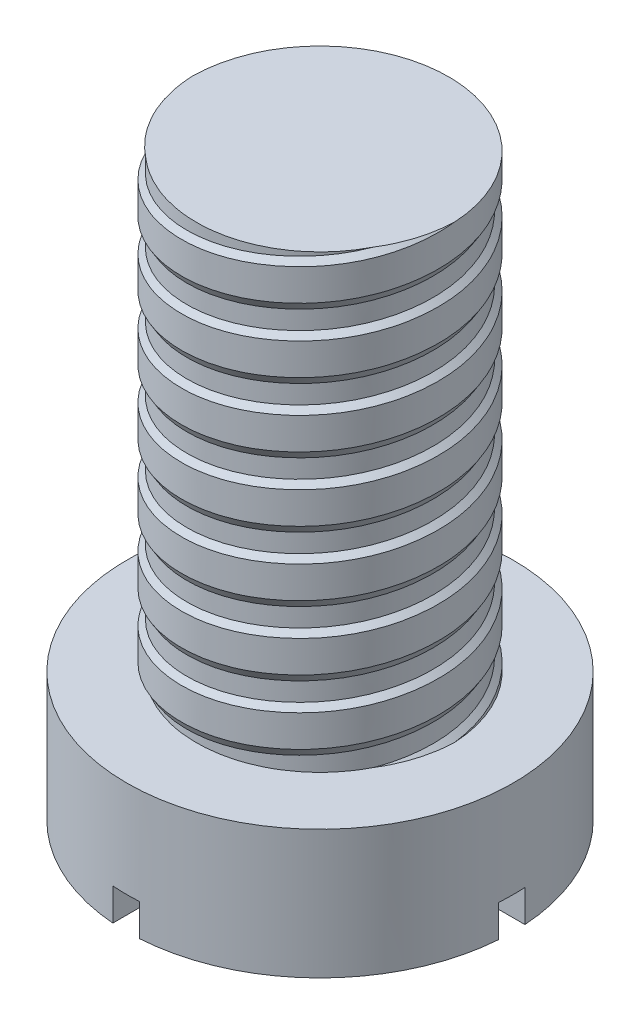
from build123d import *

# Parameters (mm, degrees)
SKETCH1_R           = 3
BOSS_EXTRUDE1_DEPTH = 2
SKETCH2_R           = 2
BOSS_EXTRUDE2_DEPTH = 7
CUT_SWEEP1_PITCH    = 1
CUT_SWEEP1_TO       = 8
SKETCH5_W           = 0.418370382
SKETCH5_H           = 0.410002974
CUT_EXTRUDE1_DEPTH  = 0.5


with BuildPart() as part:
    # Sketch1 → Boss-Extrude1 (new body)
    with BuildSketch(Plane(origin=(0, 0, 0), x_dir=(1, 0, 0), z_dir=(0, 1, 0))):
        with Locations(Location((0, 0, 0), (0, 0, 270))):
            Circle(SKETCH1_R)
    extrude(amount=BOSS_EXTRUDE1_DEPTH)

    # Sketch2 → Boss-Extrude2 (add)
    with BuildSketch(Plane(origin=(0, 2, 0), x_dir=(1, 0, 0), z_dir=(0, 1, 0))):
        with Locations(Location((0, 0, 0), (0, 0, 270))):
            Circle(SKETCH2_R)
    extrude(amount=BOSS_EXTRUDE2_DEPTH)

    # Cut-Sweep1: arcs per turn and ends read off the stored shape
    # Cut-Sweep1: the profile of Sketch4 profile screwed along a right-hand helix through 8.5 turns, 8 arcs to a turn; built about Z, then put on its axis
    cut_sweep1_z = Axis((0, 0, 0), (0, 0, 1))
    cut_sweep1_corners = [(2.000281922, 0, -0.00116889), (1.917384358, 0, 0.136008219), (1.917384358, 0, 0.424438129), (2.000281922, 0, 0.507335693)]
    with BuildLine(mode=Mode.PRIVATE) as cut_sweep1_profile:
        Line(cut_sweep1_corners[0], cut_sweep1_corners[1])
        Line(cut_sweep1_corners[1], cut_sweep1_corners[2])
        Line(cut_sweep1_corners[2], cut_sweep1_corners[3])
        Line(cut_sweep1_corners[3], cut_sweep1_corners[0])
    cut_sweep1_cap = Face(cut_sweep1_profile.wire())
    cut_sweep1_turn_angles = [0, 22.5, 45, 67.5, 90, 112.5, 135, 157.5, 180, 202.5, 225, 247.5, 270, 292.5, 315, 337.5, 360]
    cut_sweep1_turn_weights = [1, 0.9238795325112867, 1, 0.9238795325112867, 1, 0.9238795325112867, 1, 0.9238795325112867, 1, 0.9238795325112867, 1, 0.9238795325112867, 1, 0.9238795325112867, 1, 0.9238795325112867, 1]
    cut_sweep1_turn_rails = [Edge.make_bspline([Vector(p[0], p[1], 0).rotate(cut_sweep1_z, cut_sweep1_turn_angles[k]) / cut_sweep1_turn_weights[k] + Vector(0, 0, p[2] + CUT_SWEEP1_PITCH * cut_sweep1_turn_angles[k] / 360) for k in range(17)], [0, 0, 0, 1, 1, 2, 2, 3, 3, 4, 4, 5, 5, 6, 6, 7, 7, 8, 8, 8], 2, cut_sweep1_turn_weights) for p in cut_sweep1_corners]
    cut_sweep1_turn_sides = [Face.make_surface_from_curves(cut_sweep1_turn_rails[p[0]], cut_sweep1_turn_rails[p[1]]) for p in [(0, 1), (1, 2), (2, 3), (3, 0)]]
    cut_sweep1_last_angles = [2880, 2902.5, 2925, 2947.5, 2970, 2992.5, 3015, 3037.5, 3060]
    cut_sweep1_last_weights = [1, 0.9238795325112867, 1, 0.9238795325112867, 1, 0.9238795325112867, 1, 0.9238795325112867, 1]
    cut_sweep1_last_rails = [Edge.make_bspline([Vector(p[0], p[1], 0).rotate(cut_sweep1_z, cut_sweep1_last_angles[k]) / cut_sweep1_last_weights[k] + Vector(0, 0, p[2] + CUT_SWEEP1_PITCH * cut_sweep1_last_angles[k] / 360) for k in range(9)], [0, 0, 0, 1, 1, 2, 2, 3, 3, 4, 4, 4], 2, cut_sweep1_last_weights) for p in cut_sweep1_corners]
    cut_sweep1_last_sides = [Face.make_surface_from_curves(cut_sweep1_last_rails[p[0]], cut_sweep1_last_rails[p[1]]) for p in [(0, 1), (1, 2), (2, 3), (3, 0)]]
    cut_sweep1 = Plane(origin=(0, 10, 0), x_dir=(-1, 0, 0), z_dir=(0, -1, 0)) * split(Solid(Shell([*[p.moved(Location((0, 0, CUT_SWEEP1_PITCH * i))) for i in range(8) for p in cut_sweep1_turn_sides], *cut_sweep1_last_sides, cut_sweep1_cap, cut_sweep1_cap.rotate(cut_sweep1_z, 3060).moved(Location((0, 0, CUT_SWEEP1_PITCH * 3060 / 360)))])), bisect_by=Plane.XY.offset(CUT_SWEEP1_TO), keep=Keep.BOTTOM, mode=Mode.PRIVATE)
    add(cut_sweep1, mode=Mode.SUBTRACT)

    # Sketch5 → Cut-Extrude1 (cut)
    with BuildSketch(Plane.XZ):
        with BuildLine():
            Line((-0.225920006, -0.188266672), (-0.225920006, 0.221736302))
            Line((-0.225920006, 0.221736302), (-2.99179428, 0.221736302))
            ThreePointArc((-2.99179428, 0.221736302), (-2.999953105, 0.016774026), (-2.994086782, -0.188266672))
            Line((-2.994086782, -0.188266672), (-0.225920006, -0.188266672))
        make_face()
        with BuildLine():
            Line((2.99179428, 0.221736302), (0.192450376, 0.221736302))
            Line((0.192450376, 0.221736302), (0.192450376, -0.188266672))
            Line((0.192450376, -0.188266672), (2.994086782, -0.188266672))
            ThreePointArc((2.994086782, -0.188266672), (2.998521331, -0.094179756), (3, 0))
            ThreePointArc((3, 0), (2.997947868, 0.110944042), (2.99179428, 0.221736302))
        make_face()
        with Locations((-0.016734815, 0.016734815)):
            Rectangle(SKETCH5_W, SKETCH5_H)
        with BuildLine():
            ThreePointArc((0.192450376, 2.993820778), (-0.016775648, 2.999953096), (-0.225920006, 2.991481264))
            Line((-0.225920006, 2.991481264), (-0.225920006, 0.221736302))
            Line((-0.225920006, 0.221736302), (0.192450376, 0.221736302))
            Line((0.192450376, 0.221736302), (0.192450376, 2.993820778))
        make_face()
        with BuildLine():
            Line((0.192450376, -0.188266672), (-0.225920006, -0.188266672))
            Line((-0.225920006, -0.188266672), (-0.225920006, -2.991481264))
            ThreePointArc((-0.225920006, -2.991481264), (-0.016775648, -2.999953096), (0.192450376, -2.993820778))
            Line((0.192450376, -2.993820778), (0.192450376, -0.188266672))
        make_face()
    extrude(amount=-CUT_EXTRUDE1_DEPTH, mode=Mode.SUBTRACT)


solid = part.part
